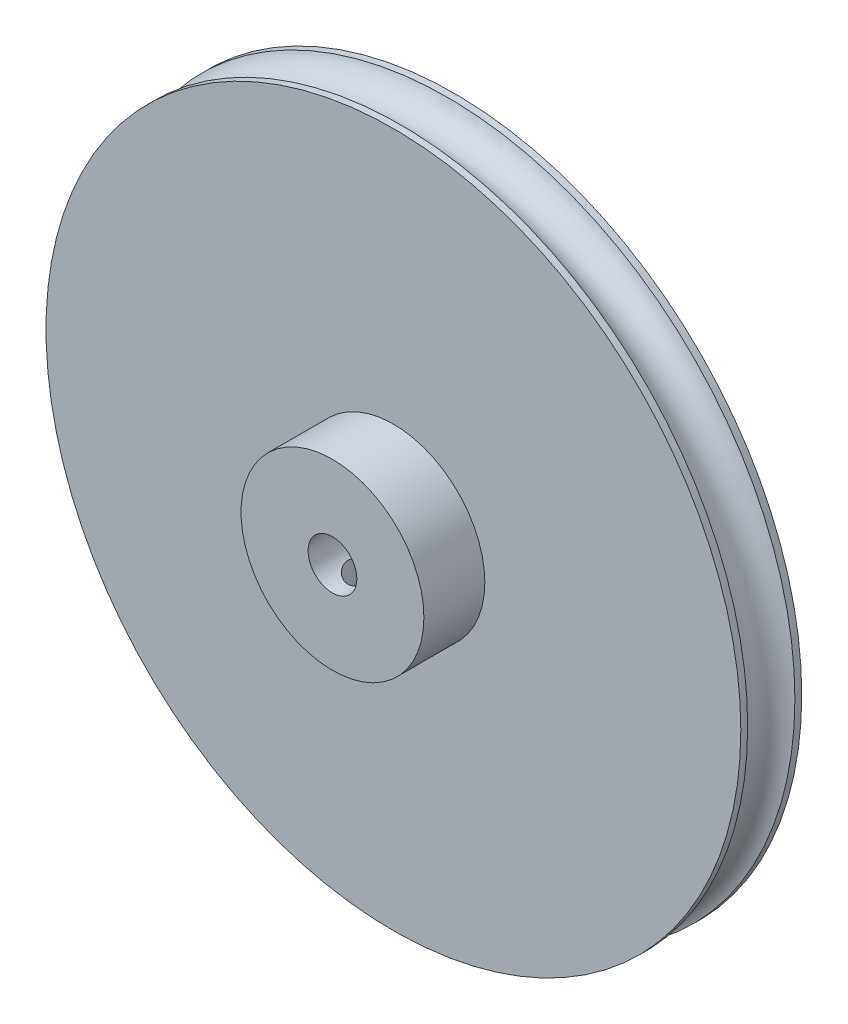
from build123d import *

# Parameters (mm, degrees)
ESQUISSE1_R      = 28.5
EXTRUSION1_DEPTH = 5
ESQUISSE2_R      = 7.5
EXTRUSION2_DEPTH = 5
EXTRUSION3_REACH = 43.527
ESQUISSE3_R      = 2
ESQUISSE12_W     = 1.25
ESQUISSE12_H     = 28.5


with BuildPart() as part:
    # Esquisse1 → Extrusion1 (new body)
    with BuildSketch(Plane.XY):
        Circle(ESQUISSE1_R)
    extrude(amount=-EXTRUSION1_DEPTH)

    # Esquisse2 → Extrusion2 (add)
    with BuildSketch(Plane.XY):
        Circle(ESQUISSE2_R)
    extrude(amount=EXTRUSION2_DEPTH)

    # Esquisse3 → Extrusion3 (cut, up to next)
    with BuildSketch(Plane.XY.offset(5), mode=Mode.PRIVATE) as extrusion3_sk1:
        Circle(ESQUISSE3_R)
    extrusion3_tool1 = extrude(extrusion3_sk1.sketch, amount=-EXTRUSION3_REACH, mode=Mode.PRIVATE) & part.part
    add(extrusion3_tool1.solids().sort_by_distance((0, 0, 5))[0], mode=Mode.SUBTRACT)

    # Esquisse6 → Enlèvement de matière-Révolution3 (revolve, cut)
    with BuildSketch(Plane(origin=(0, 0, 0), x_dir=(1, 0, 0), z_dir=(0, 1, 0))):
        with BuildLine():
            Line((-29, 4.5), (-31.449617094, 4.5))
            Line((-31.449617094, 4.5), (-31.449617094, 0.5))
            Line((-31.449617094, 0.5), (-29, 0.5))
            ThreePointArc((-29, 0.5), (-27, 2.5), (-29, 4.5))
        make_face()
    revolve(axis=Axis((0, 0, 5), (0, 0, -1)), mode=Mode.SUBTRACT)

    # Esquisse12 → Trou taraudé M3x0.55 (revolve, cut)
    with BuildSketch(Plane(origin=(0, 0, 2.5), x_dir=(0, 0, 1), z_dir=(1, 0, 0))):
        with Locations((0.625, 14.25)):
            Rectangle(ESQUISSE12_W, ESQUISSE12_H)
    revolve(axis=Axis((0, 6.35, 2.5), (0, -1, 0)), mode=Mode.SUBTRACT)


solid = part.part
